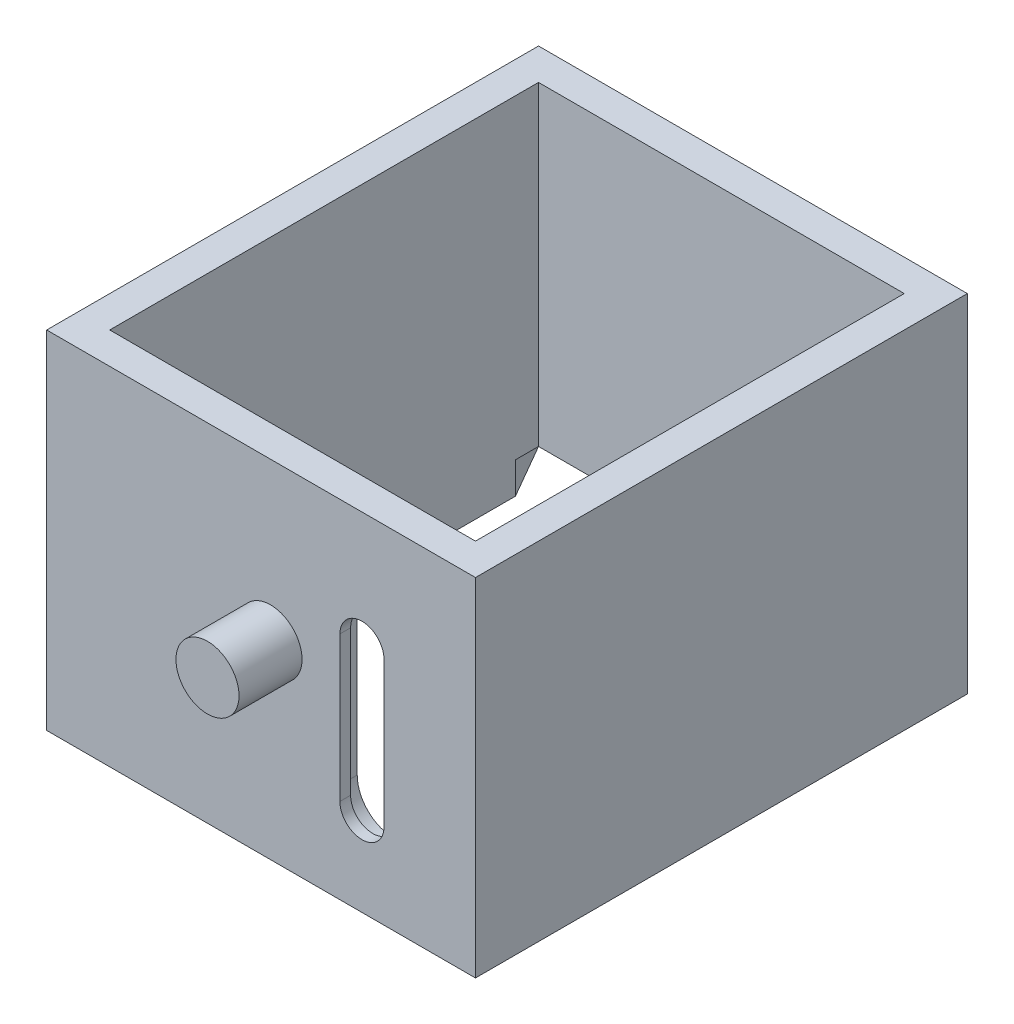
from build123d import *

# Parameters (mm, degrees)
SKIZZE1_W                                      = 68
SKIZZE1_H                                      = 55
AUFSATZ_LINEAR_AUSTRAGEN1_DEPTH                = 78
SKIZZE2_W                                      = 58
SKIZZE2_H                                      = 68
SCHNITT_LINEAR_AUSTRAGEN1_DEPTH                = 118.187883333
SKIZZE3_R                                      = 5
AUFSATZ_LINEAR_AUSTRAGEN2_DEPTH                = 10
STIRNSENKUNG_START                             = 73
STIRNSENKUNG_LANGLOCH_F_R_M6_SENKSCHRAUB_DEPTH = 3.3
STIRNSENKUNG_START_2                           = 76.3
STIRNSENKUNG_LANGLOCH_F_R_M6_SENKSCH_3_DEPTH   = 1.7
SCHNITT_LINEAR_AUSTRAGEN2_DEPTH                = 5


# Read off the part's stored shape, not the designer's step: Stirnsenkung Langloch für M6 Senkschraube (Kopf Button)1
with BuildPart() as part:
    # Skizze1 → Aufsatz-Linear austragen1 (new body)
    with BuildSketch(Plane.XY):
        with Locations((-34, 27.5)):
            Rectangle(SKIZZE1_W, SKIZZE1_H)
    extrude(amount=AUFSATZ_LINEAR_AUSTRAGEN1_DEPTH)

    # Skizze2 → Schnitt-Linear austragen1 (cut, through all)
    with BuildSketch(Plane(origin=(0, 55, 0), x_dir=(1, 0, 0), z_dir=(0, 1, 0))):
        with Locations((-34, -39)):
            Rectangle(SKIZZE2_W, SKIZZE2_H)
    extrude(amount=-SCHNITT_LINEAR_AUSTRAGEN1_DEPTH, mode=Mode.SUBTRACT)

    # Skizze3 → Aufsatz-Linear austragen2 (add)
    with BuildSketch(Plane.XY.offset(78)):
        with Locations((-32.5, 30)):
            Circle(SKIZZE3_R)
    extrude(amount=AUFSATZ_LINEAR_AUSTRAGEN2_DEPTH)

    # Stirnsenkung Langloch f_r M6 Senksch 2 → Stirnsenkung Langloch für M6 Senkschraube (Kopf Button)1 (cut)
    with BuildSketch(Plane.XY.offset(STIRNSENKUNG_START)):
        with BuildLine():
            ThreePointArc((-12.25, 36.5), (-18, 42.25), (-23.75, 36.5))
            Line((-23.75, 36.5), (-23.75, 13.5))
            ThreePointArc((-23.75, 13.5), (-18, 7.75), (-12.25, 13.5))
            Line((-12.25, 13.5), (-12.25, 36.5))
        make_face()
    extrude(amount=STIRNSENKUNG_LANGLOCH_F_R_M6_SENKSCHRAUB_DEPTH, mode=Mode.SUBTRACT)

    # Stirnsenkung Langloch f_r M6 Senksch 3 o → Stirnsenkung Langloch f_r M6 Senksch 3 (cut)
    with BuildSketch(Plane.XY.offset(STIRNSENKUNG_START_2)):
        with BuildLine():
            ThreePointArc((-14.5, 36.5), (-18, 40), (-21.5, 36.5))
            Line((-21.5, 36.5), (-21.5, 13.5))
            ThreePointArc((-21.5, 13.5), (-18, 10), (-14.5, 13.5))
            Line((-14.5, 13.5), (-14.5, 36.5))
        make_face()
    extrude(amount=STIRNSENKUNG_LANGLOCH_F_R_M6_SENKSCH_3_DEPTH, mode=Mode.SUBTRACT)

    # Skizze15 → Schnitt-Linear austragen2 (cut)
    with BuildSketch(Plane.XZ):
        Polygon((0, 0), (-5, 8.660254038), (-63, 8.660254038), (-68, 0), align=None)
    extrude(amount=-SCHNITT_LINEAR_AUSTRAGEN2_DEPTH, mode=Mode.SUBTRACT)


solid = part.part
